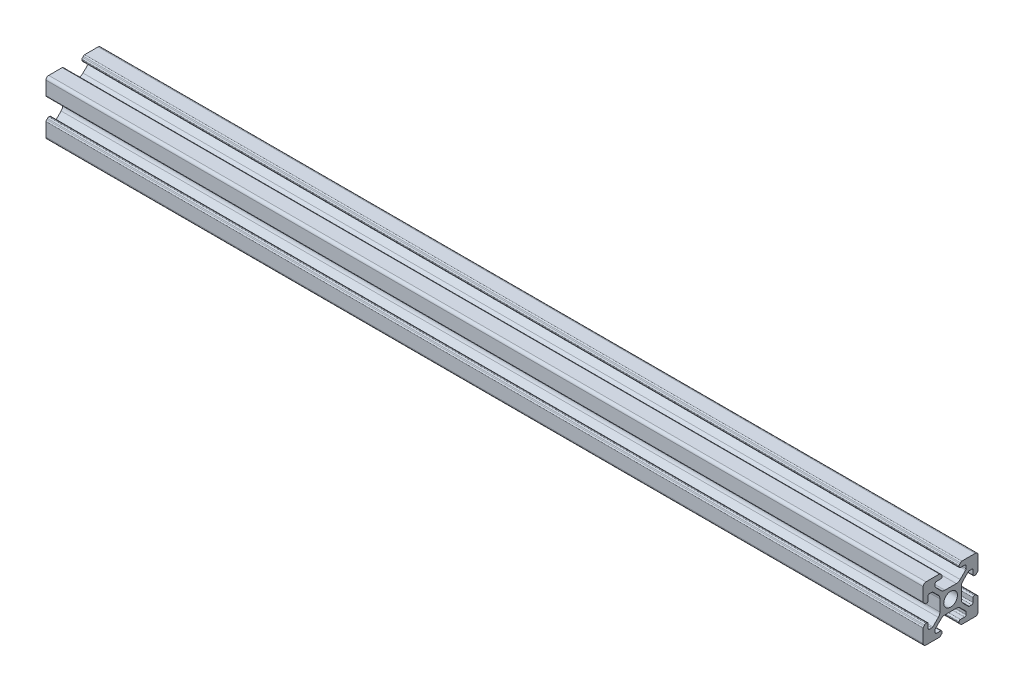
from build123d import *

# Parameters (mm, degrees)
SKETCH1_W                = 20
SKETCH1_H                = 20
BOSS_EXTRUDE1_DEPTH      = 320
FILLET1_R                = 1
CUT_EXTRUDE1_DEPTH       = 321.312347561
F_5_0_5_DIAMETER_HOLE1_D = 5
FILLET2_R                = 2
FILLET3_R                = 0.5
FILLET4_R                = 0.5
FILLET5_R                = 0.5


with BuildPart() as part:
    # Sketch1 → Boss-Extrude1 (new body)
    with BuildSketch(Plane(origin=(0, 0, 0), x_dir=(0, 0, -1), z_dir=(1, 0, 0))):
        Rectangle(SKETCH1_W, SKETCH1_H)
    extrude(amount=BOSS_EXTRUDE1_DEPTH)

    # Fillet1
    fillet1_edges = [part.edges().sort_by_distance(p)[0] for p in [
        (160, 10, 10),
        (160, 10, -10),
        (160, -10, -10),
        (160, -10, 10),
    ]]
    fillet(fillet1_edges, radius=FILLET1_R)

    # Sketch3 → Cut-Extrude1 (cut, through all)
    with BuildSketch(Plane.ZY):
        Polygon((-3.6, 10), (3.6, 10), (3.6, 9.5), (3.1, 9.5), (3.1, 8.2), (5.63, 8.2), (5.63, 6.619949494), (2.910050506, 3.9), (-2.910050506, 3.9), (-5.63, 6.619949494), (-5.63, 8.2), (-3.1, 8.2), (-3.1, 9.5), (-3.6, 9.5), align=None)
        Polygon((10, 3.6), (10, -3.6), (9.5, -3.6), (9.5, -3.1), (8.2, -3.1), (8.2, -5.63), (6.619949494, -5.63), (3.9, -2.910050506), (3.9, 2.910050506), (6.619949494, 5.63), (8.2, 5.63), (8.2, 3.1), (9.5, 3.1), (9.5, 3.6), align=None)
        Polygon((3.6, -10), (-3.6, -10), (-3.6, -9.5), (-3.1, -9.5), (-3.1, -8.2), (-5.63, -8.2), (-5.63, -6.619949494), (-2.910050506, -3.9), (2.910050506, -3.9), (5.63, -6.619949494), (5.63, -8.2), (3.1, -8.2), (3.1, -9.5), (3.6, -9.5), align=None)
        Polygon((-10, -3.6), (-10, 3.6), (-9.5, 3.6), (-9.5, 3.1), (-8.2, 3.1), (-8.2, 5.63), (-6.619949494, 5.63), (-3.9, 2.910050506), (-3.9, -2.910050506), (-6.619949494, -5.63), (-8.2, -5.63), (-8.2, -3.1), (-9.5, -3.1), (-9.5, -3.6), align=None)
    extrude(amount=-CUT_EXTRUDE1_DEPTH, mode=Mode.SUBTRACT)

    # Ø5.0 (5) Diameter Hole1 (through all)
    with Locations(Plane.ZY):
        with Locations((0, 0)):
            Hole(F_5_0_5_DIAMETER_HOLE1_D / 2)

    # Fillet2
    fillet2_edges = [part.edges().sort_by_distance(p)[0] for p in [
        (160, -3.9, -2.910050506),
        (160, -3.9, 2.910050506),
        (160, 2.910050506, -3.9),
        (160, -2.910050506, -3.9),
        (160, -2.910050506, 3.9),
        (160, 2.910050506, 3.9),
        (160, 3.9, 2.910050506),
        (160, 3.9, -2.910050506),
    ]]
    fillet(fillet2_edges, radius=FILLET2_R)

    # Fillet3
    fillet3_edges = [part.edges().sort_by_distance(p)[0] for p in [
        (160, 3.6, -10),
        (160, 3.1, -9.5),
        (160, 3.1, -8.2),
        (160, 5.63, -8.2),
        (160, 5.63, -6.619949494),
        (160, 3.6, 10),
        (160, 3.1, 9.5),
        (160, 3.1, 8.2),
        (160, 5.63, 8.2),
        (160, 5.63, 6.619949494),
        (160, 6.619949494, 5.63),
        (160, 8.2, 5.63),
        (160, 8.2, 3.1),
        (160, 9.5, 3.1),
        (160, 10, 3.6),
        (160, 9.5, -3.1),
        (160, 10, -3.6),
        (160, 8.2, -3.1),
        (160, 8.2, -5.63),
        (160, 6.619949494, -5.63),
    ]]
    fillet(fillet3_edges, radius=FILLET3_R - 0.0001)  # a hair under: the kernel refuses the full size

    # Fillet4
    fillet4_edges = [part.edges().sort_by_distance(p)[0] for p in [
        (160, -3.6, 10),
        (160, -3.1, 9.5),
        (160, -3.1, 8.2),
        (160, -5.63, 8.2),
        (160, -5.63, 6.619949494),
        (160, -6.619949494, 5.63),
        (160, -8.2, 5.63),
        (160, -8.2, 3.1),
        (160, -10, 3.6),
        (160, -9.5, 3.1),
        (160, -10, -3.6),
        (160, -9.5, -3.1),
        (160, -8.2, -3.1),
        (160, -8.2, -5.63),
        (160, -6.619949494, -5.63),
        (160, -5.63, -6.619949494),
        (160, -5.63, -8.2),
        (160, -3.1, -8.2),
        (160, -3.1, -9.5),
        (160, -3.6, -10),
    ]]
    fillet(fillet4_edges, radius=FILLET4_R - 0.0001)  # a hair under: the kernel refuses the full size

    # Fillet5
    fillet5_edges = [part.edges().sort_by_distance(p)[0] for p in [
        (160, 3.6, 9.5),
        (160, 9.5, 3.6),
        (160, 9.5, -3.6),
        (160, 3.6, -9.5),
        (160, -3.6, 9.5),
        (160, -9.5, 3.6),
        (160, -9.5, -3.6),
        (160, -3.6, -9.5),
    ]]
    fillet(fillet5_edges, radius=FILLET5_R)


solid = part.part
